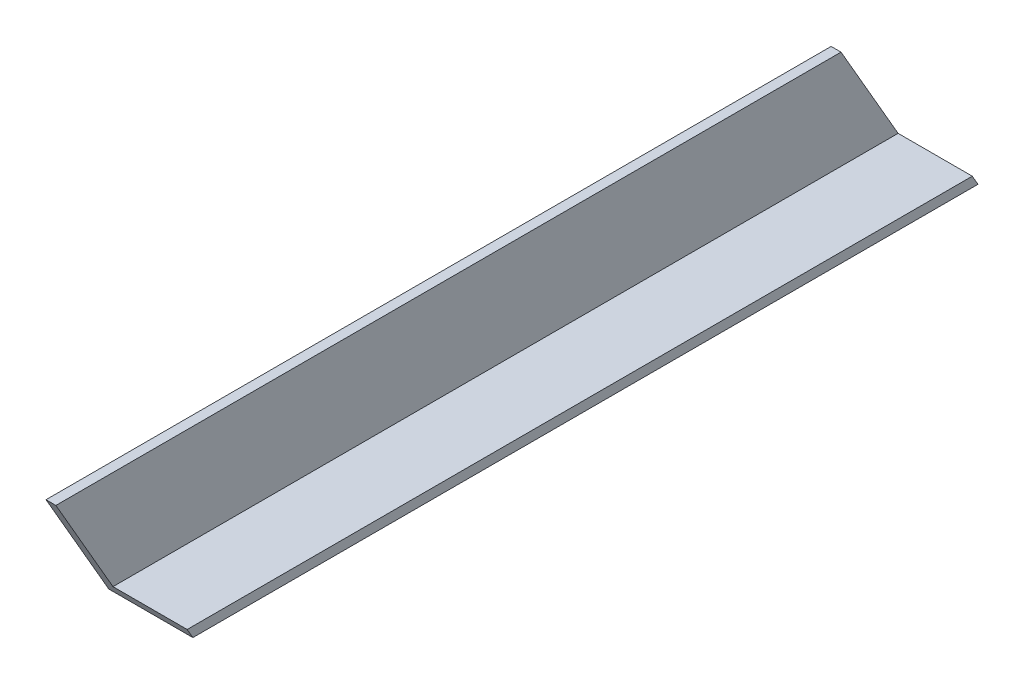
from build123d import *

# Parameters (mm, degrees)
BOSS_EXTRUDE1_DEPTH = 250
CUT_EXTRUDE1_DEPTH  = 150


with BuildPart() as part:
    # Sketch1 → Boss-Extrude1 (new body)
    with BuildSketch(Plane.XY):
        Polygon((0, 0), (0, 22), (2, 22), (2, 2), (17, 2), (17, 0), align=None)
    extrude(amount=BOSS_EXTRUDE1_DEPTH)

    # Sketch2 → Cut-Extrude1 (cut)
    with BuildSketch(Plane(origin=(17, 0, 0), x_dir=(0, 0, -1), z_dir=(1, 0, 0))):
        Polygon((-171.473029949, 22), (-250, 22), (-250, 0), (-158.771324027, 0), align=None)
        Polygon((-12.701705922, 22), (0, 22), (0, 0), align=None)
    extrude(amount=-CUT_EXTRUDE1_DEPTH, mode=Mode.SUBTRACT)


solid = part.part
